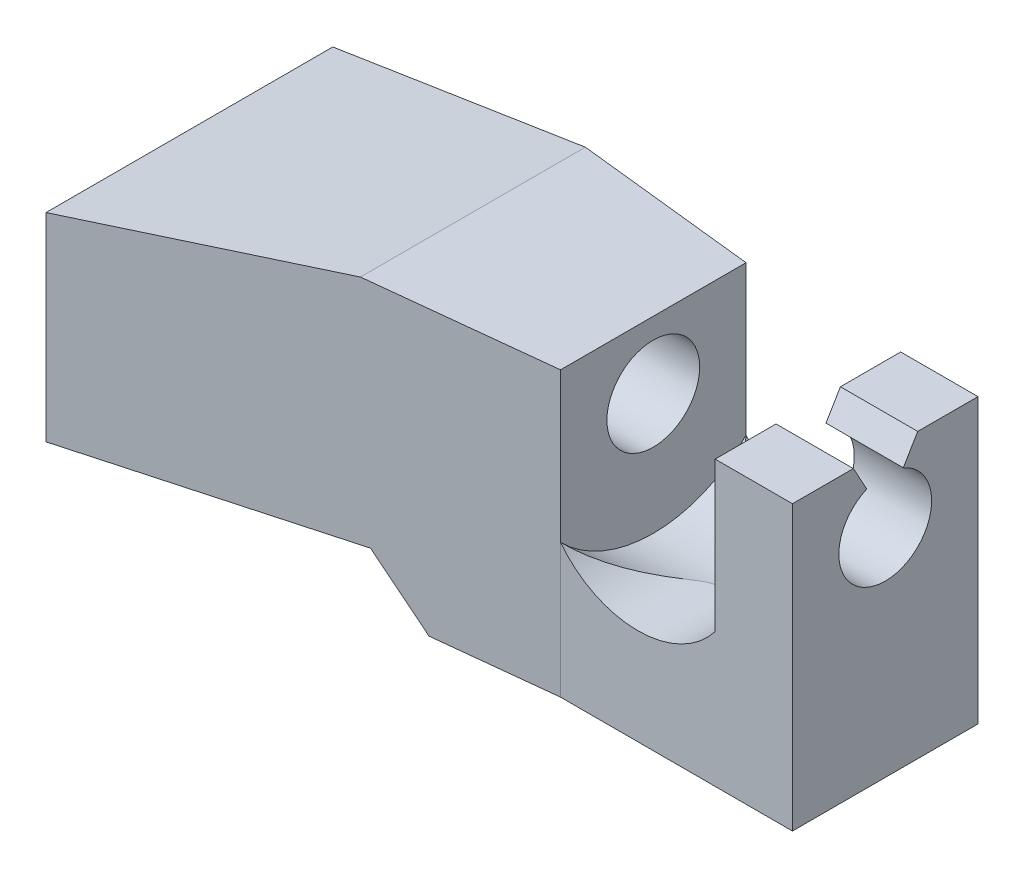
from build123d import *
from OCP.BRepAlgoAPI import BRepAlgoAPI_Cut
from OCP.TopTools import TopTools_ListOfShape

# Parameters (mm, degrees)
SKETCH1_R               = 10
BOSS_EXTRUDE2_DEPTH     = 30
SKETCH4_R               = 10
CUT_EXTRUDE1_DEPTH      = 15
CHAMFER1_SIZE           = 20
CUT_EXTRUDE2_DEPTH      = 174.638139858
CUT_EXTRUDE2_DEPTH_BACK = 174.638139858
BOSS_EXTRUDE3_DEPTH     = 45
CUT_EXTRUDE3_DEPTH      = 198.547978004
CUT_EXTRUDE3_DEPTH_BACK = 15
SKETCH6_3_R             = 9
SKETCH8_W               = 15
SKETCH8_H               = 36
BOSS_EXTRUDE4_DEPTH     = 45.000002
SKETCH10_R              = 9
CUT_EXTRUDE4_DEPTH      = 198.547978004
BOSS_EXTRUDE5_DEPTH     = 10
CHAMFER2_SIZE           = 12
CUT_EXTRUDE5_DEPTH      = 40
CUT_EXTRUDE6_DEPTH      = 217.852953896
CUT_EXTRUDE6_DEPTH_BACK = 217.852953896
SKETCH14_W              = 100
SKETCH14_H              = 60
CUT_EXTRUDE7_DEPTH      = 145.655593904
CUT_EXTRUDE7_DEPTH_BACK = 10
SKETCH16_R              = 10
CUT_EXTRUDE8_DEPTH      = 15


# Some blends are built 0.0001 mm under size
with BuildPart() as part:
    # Sketch1 → Boss-Extrude2 (new, symmetric)
    # profile 1 of 3: a face of its own
    with BuildSketch(Plane.XY):
        Polygon((25, -10), (-4.997737685, -45.002262315), (-25, -25), (-25, 25), (25, 25), align=None)
        Circle(SKETCH1_R, mode=Mode.SUBTRACT)
    # profile 2 of 3: a face of its own
    with BuildSketch(Plane.XY):
        Polygon((45, -10), (25, -10), (-4.997737685, -45.002262315), (45.002262315, -45.002262315), (75, -41.079226753), (75, -2.548159698), align=None)
    # profile 3 of 3: a face of its own
    with BuildSketch(Plane.XY):
        Polygon((130, 11.113547523), (75, -2.548159698), (75, -41.079226753), (130, -33.886452477), (165, -33.886452477), (165, 11.113547523), align=None)
    extrude(amount=BOSS_EXTRUDE2_DEPTH, both=True)

    # Sketch4 → Cut-Extrude1 (cut, symmetric)
    with BuildSketch(Plane.XY):
        Polygon((25, -10), (-4.997737685, -45.002262315), (-25, -25), (-25, 25), (25, 25), align=None)
        Circle(SKETCH4_R, mode=Mode.SUBTRACT)
    extrude(amount=CUT_EXTRUDE1_DEPTH, both=True, mode=Mode.SUBTRACT)

    # Chamfer1
    chamfer1_edges = [part.edges().sort_by_distance(p)[0] for p in [
        (25, -10, -22.5),
        (25, -10, 22.5),
    ]]
    chamfer(chamfer1_edges, length=CHAMFER1_SIZE - 0.0001)  # a hair under: the kernel refuses the full size

    # Sketch5 → Cut-Extrude2 (cut, two sides: drawn at the far end of the back side and taken through both)
    with BuildSketch(Plane(origin=(0, 0, 0), x_dir=(1, 0, 0), z_dir=(0, 1, 0)).offset(-CUT_EXTRUDE2_DEPTH_BACK)):
        Polygon((165, -30), (165, -18), (55.074227224, -30), align=None)
        Polygon((165, 18), (165, 30), (55.074227224, 30), align=None)
    extrude(amount=CUT_EXTRUDE2_DEPTH + CUT_EXTRUDE2_DEPTH_BACK, mode=Mode.SUBTRACT)

    # Sketch6 → Boss-Extrude3 (add)
    with BuildSketch(Plane(origin=(165, 0, 0), x_dir=(0, 0, -1), z_dir=(1, 0, 0))):
        with BuildLine():
            Line((-18, -33.886452477), (18, -33.886452477))
            Line((18, -33.886452477), (18, -17.886452477))
            ThreePointArc((18, -17.886452477), (0, -25.375680921), (-18, -17.886452477))
            Line((-18, -17.886452477), (-18, -33.886452477))
        make_face()
    extrude(amount=BOSS_EXTRUDE3_DEPTH)

    # Sketch6<3> → Cut-Extrude3 (cut, two sides: drawn at the far end of the back side and taken through both)
    with BuildSketch(Plane(origin=(165, 0, 0), x_dir=(0, 0, -1), z_dir=(1, 0, 0)).offset(-CUT_EXTRUDE3_DEPTH_BACK)):
        with Locations(Location((0, -1.886452477, 0), (0, 0, 90))):
            Circle(SKETCH6_3_R)
    extrude(amount=CUT_EXTRUDE3_DEPTH + CUT_EXTRUDE3_DEPTH_BACK, mode=Mode.SUBTRACT)

    # Sketch8 → Boss-Extrude4 (add)
    with BuildSketch(Plane.XZ.offset(33.886452477)):
        with Locations((202.5, 0)):
            Rectangle(SKETCH8_W, SKETCH8_H)
    extrude(amount=-BOSS_EXTRUDE4_DEPTH)

    # Sketch10 → Cut-Extrude4 (cut, through all)
    with BuildSketch(Plane(origin=(165, 0, 0), x_dir=(0, 0, -1), z_dir=(1, 0, 0))):
        with Locations(Location((0, -1.886452477, 0), (0, 0, 90))):
            Circle(SKETCH10_R)
    extrude(amount=CUT_EXTRUDE4_DEPTH, mode=Mode.SUBTRACT)

    # Sketch11 → Boss-Extrude5 (add)
    with BuildSketch(Plane.XZ.offset(33.886452477)):
        Polygon((130, 21.82076004), (130, -21.82076004), (165, -18), (210, -18), (210, 18), (165, 18), align=None)
    extrude(amount=BOSS_EXTRUDE5_DEPTH)

    # Chamfer2
    # the kernel refuses this chamfer: 12 mm, written as the material it takes off along each edge
    with BuildSketch(Plane(origin=(130, -43.886452477, 52.680955896), x_dir=(0, 1, 0), z_dir=(0, 0, -1))) as chamfer2_piece_1_section:
        Polygon((CHAMFER2_SIZE, 0), (0, CHAMFER2_SIZE), (0, 0), align=None)
    chamfer2_piece_1 = extrude(amount=105.361911791, mode=Mode.PRIVATE)
    chamfer2_piece_1 = split(chamfer2_piece_1, bisect_by=Plane(origin=(128.714213423, -34.054604706, 52.680955896), z_dir=(0.1296735244167249, -0.9915567442488328, 0)), keep=Keep.TOP, mode=Mode.PRIVATE)
    add(chamfer2_piece_1, mode=Mode.SUBTRACT)

    # Sketch13 → Cut-Extrude5 (cut)
    with BuildSketch(Plane.XY.offset(18)):
        with BuildLine():
            Line((165, -17.886452477), (195, -17.886452477))
            ThreePointArc((195, -17.886452477), (180, -25.224548687), (165, -17.886452477))
        make_face()
    extrude(amount=-CUT_EXTRUDE5_DEPTH, mode=Mode.SUBTRACT)

    # Sketch14 → Cut-Extrude6 (cut, two sides: drawn at the far end of the back side and taken through both)
    with BuildSketch(Plane(origin=(0, 0, 0), x_dir=(1, 0, 0), z_dir=(0, 1, 0)).offset(-CUT_EXTRUDE6_DEPTH_BACK)):
        with Locations((25, 0)):
            Rectangle(SKETCH14_W, SKETCH14_H)
    extrude(amount=CUT_EXTRUDE6_DEPTH + CUT_EXTRUDE6_DEPTH_BACK, mode=Mode.SUBTRACT)

    # Sketch16 → Cut-Extrude7 (cut, two sides: drawn at the far end of the back side and taken through both)
    with BuildSketch(Plane.ZY.offset(-75).offset(-CUT_EXTRUDE7_DEPTH_BACK)):
        with Locations(Location((0, -20.03233432, 0), (0, 0, 180))):
            Circle(SKETCH16_R)
    extrude(amount=CUT_EXTRUDE7_DEPTH + CUT_EXTRUDE7_DEPTH_BACK, mode=Mode.SUBTRACT)


with BuildPart() as cut_extrude8_tool:
    # Sketch17 → Cut-Extrude8 (new body)
    with BuildSketch(Plane(origin=(210, 0, 0), x_dir=(0, 0, -1), z_dir=(1, 0, 0))):
        with BuildLine():
            Line((-6.182771984, 11.113547523), (-3.573497387, 6.373699848))
            ThreePointArc((-3.573497387, 6.373699848), (-0.036026842, 7.113475415), (3.507252904, 6.402044194))
            Line((3.507252904, 6.402044194), (6.304774933, 11.113547523))
            Line((6.304774933, 11.113547523), (-6.182771984, 11.113547523))
        make_face()
    extrude(amount=-CUT_EXTRUDE8_DEPTH)


with BuildPart() as part_1:
    add(part.part)

    # Cut-Extrude8: cut by cut_extrude8_tool, with a tolerance
    cut_extrude8_stock = TopTools_ListOfShape()
    cut_extrude8_stock.Append(part_1.part.wrapped)
    cut_extrude8_tools = TopTools_ListOfShape()
    cut_extrude8_tools.Append(cut_extrude8_tool.part.wrapped)
    cut_extrude8_cut = BRepAlgoAPI_Cut()
    cut_extrude8_cut.SetArguments(cut_extrude8_stock)
    cut_extrude8_cut.SetTools(cut_extrude8_tools)
    cut_extrude8_cut.SetFuzzyValue(0.00001)
    cut_extrude8_cut.Build()
    add(Compound.cast(cut_extrude8_cut.Shape()).solids(), mode=Mode.REPLACE)


solid = part_1.part
